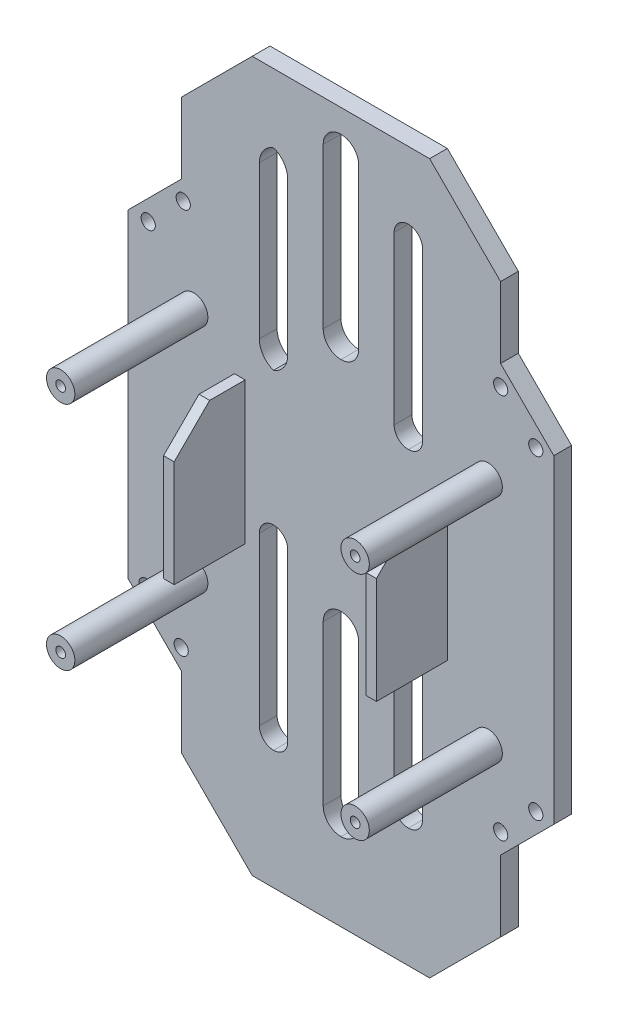
from build123d import *

# Parameters (mm, degrees)
ESQUISSE1_W             = 120
ESQUISSE1_H             = 120
BOSS_EXTRU_2_DEPTH      = 5
ESQUISSE9_R             = 4
BOSS_EXTRU_4_DEPTH      = 37.5
CHANFREIN5_SIZE         = 15
CHANFREIN6_SIZE         = 15
CHANFREIN7_SIZE         = 15
CHANFREIN8_SIZE         = 15
D_GAGEMENT_61_D         = 2.75
D_GAGEMENT_61_DEPTH     = 15
D_GAGEMENT_61_TIP       = 0.826183351
ESQUISSE21_W            = 90
ESQUISSE21_H            = 5
BOSS_EXTRU_7_DEPTH      = 40
ESQUISSE22_W            = 90
ESQUISSE22_H            = 5
BOSS_EXTRU_8_DEPTH      = 40
CHANFREIN23_SIZE        = 20
ESQUISSE23_R            = 2
ENL_V_MAT_EXTRU_1_DEPTH = 10
SKETCH1_W               = 10
SKETCH1_H               = 55
CUT_EXTRUDE2_DEPTH      = 5
FILLET2_R               = 5
FILLET3_R               = 5
SKETCH3_W               = 10
SKETCH3_H               = 55
CUT_EXTRUDE4_DEPTH      = 5
FILLET11_R              = 5
SKETCH2_W               = 8
SKETCH2_H               = 55
CUT_EXTRUDE5_DEPTH      = 8
SKETCH4_W               = 8
SKETCH4_H               = 55
CUT_EXTRUDE6_DEPTH      = 8
FILLET12_R              = 4
FILLET13_R              = 6
FILLET14_R              = 4
FILLET15_R              = 4
SKETCH5_W               = 3
SKETCH5_H               = 40
BOSS_EXTRUDE1_DEPTH     = 20
CHAMFER1_SIZE           = 10
CHAMFER2_SIZE           = 10


# Some blends are built 0.0001 mm under size
with BuildPart() as part:
    # Esquisse1 → Boss.-Extru.2 (new body)
    with BuildSketch(Plane.XY):
        with Locations((18.92806479, -29.794391972)):
            Rectangle(ESQUISSE1_W, ESQUISSE1_H)
    extrude(amount=BOSS_EXTRU_2_DEPTH)

    # Esquisse9 → Boss.-Extru.4 (add)
    with BuildSketch(Plane.XY.offset(5)):
        with Locations(Location((-22.57193521, -64.794391972, 0), (0, 0, 180))):
            Circle(ESQUISSE9_R)
        with Locations(Location((-22.57193521, 0.205608028, 0), (0, 0, 180))):
            Circle(ESQUISSE9_R)
        with Locations(Location((60.42806479, 0.205608028, 0), (0, 0, 180))):
            Circle(ESQUISSE9_R)
        with Locations(Location((60.42806479, -64.794391972, 0), (0, 0, 180))):
            Circle(ESQUISSE9_R)
    extrude(amount=BOSS_EXTRU_4_DEPTH)

    # Chanfrein5
    chanfrein5_edges = [part.edges().sort_by_distance(p)[0] for p in [
        (78.92806479, -89.794391972, 2.5),
    ]]
    chamfer(chanfrein5_edges, length=CHANFREIN5_SIZE)

    # Chanfrein6
    chanfrein6_edges = [part.edges().sort_by_distance(p)[0] for p in [
        (78.92806479, 30.205608028, 2.5),
    ]]
    chamfer(chanfrein6_edges, length=CHANFREIN6_SIZE)

    # Chanfrein7
    chanfrein7_edges = [part.edges().sort_by_distance(p)[0] for p in [
        (-41.07193521, 30.205608028, 2.5),
    ]]
    chamfer(chanfrein7_edges, length=CHANFREIN7_SIZE)

    # Chanfrein8
    chanfrein8_edges = [part.edges().sort_by_distance(p)[0] for p in [
        (-41.07193521, -89.794391972, 2.5),
    ]]
    chamfer(chanfrein8_edges, length=CHANFREIN8_SIZE)

    # Dégagement #61
    with Locations(Plane(origin=(-22.57193521, -64.794391972, 42.5), x_dir=(1, 0, 0), z_dir=(0, 0, 1))):
        with Locations((0, 0), (83, 0), (83, 65), (0, 65)):
            Hole(D_GAGEMENT_61_D / 2, depth=D_GAGEMENT_61_DEPTH)
            with Locations((0, 0, -(D_GAGEMENT_61_DEPTH + D_GAGEMENT_61_TIP / 2))):  # 118° drill point
                Cone(0, D_GAGEMENT_61_D / 2, D_GAGEMENT_61_TIP, mode=Mode.SUBTRACT)

    # Esquisse21 → Boss.-Extru.7 (add)
    with BuildSketch(Plane(origin=(0, -89.794391972, 0), x_dir=(-1, 0, 0), z_dir=(0, -1, 0))):
        with Locations((-18.92806479, -2.5)):
            Rectangle(ESQUISSE21_W, ESQUISSE21_H)
    extrude(amount=BOSS_EXTRU_7_DEPTH)

    # Esquisse22 → Boss.-Extru.8 (add)
    with BuildSketch(Plane(origin=(0, 30.205608028, 0), x_dir=(1, 0, 0), z_dir=(0, 1, 0))):
        with Locations((18.92806479, -2.5)):
            Rectangle(ESQUISSE22_W, ESQUISSE22_H)
    extrude(amount=BOSS_EXTRU_8_DEPTH)

    # Chanfrein23
    chanfrein23_edges = [part.edges().sort_by_distance(p)[0] for p in [
        (-26.07193521, -129.794391972, 2.5),
        (63.92806479, -129.794391972, 2.5),
        (63.92806479, 70.205608028, 2.5),
        (-26.07193521, 70.205608028, 2.5),
    ]]
    chamfer(chanfrein23_edges, length=CHANFREIN23_SIZE)

    # Esquisse23 → Enlèv. mat.-Extru.1 (cut)
    with BuildSketch(Plane.XY.offset(5)):
        with Locations((-35.996277988, -74.213194945)):
            Circle(ESQUISSE23_R)
        with Locations((-26.096783051, -84.112689881)):
            Circle(ESQUISSE23_R)
        with Locations((-25.52408096, 25.096608028)):
            Circle(ESQUISSE23_R)
        with Locations((-35.390089468, 15.163739554)):
            Circle(ESQUISSE23_R)
        with Locations((63.953155144, 24.523663425)):
            Circle(ESQUISSE23_R)
        with Locations((73.85265008, 14.624168488)):
            Circle(ESQUISSE23_R)
        with Locations((63.953210541, -84.112391972)):
            Circle(ESQUISSE23_R)
        with Locations((73.852705477, -74.212897035)):
            Circle(ESQUISSE23_R)
    extrude(amount=-ENL_V_MAT_EXTRU_1_DEPTH, mode=Mode.SUBTRACT)

    # Sketch1 → Cut-Extrude2 (cut)
    with BuildSketch(Plane.XY.offset(5)):
        with Locations((18.92806479, -80.294391972)):
            Rectangle(SKETCH1_W, SKETCH1_H)
    extrude(amount=-CUT_EXTRUDE2_DEPTH, mode=Mode.SUBTRACT)

    # Fillet2
    fillet2_edges = [part.edges().sort_by_distance(p)[0] for p in [
        (13.92806479, -107.794391972, 2.5),
    ]]
    fillet(fillet2_edges, radius=FILLET2_R)

    # Fillet3
    fillet3_edges = [part.edges().sort_by_distance(p)[0] for p in [
        (13.92806479, -52.794391972, 2.5),
        (23.92806479, -52.794391972, 2.5),
        (23.92806479, -107.794391972, 2.5),
    ]]
    fillet(fillet3_edges, radius=FILLET3_R - 0.0001)  # a hair under: the kernel refuses the full size

    # Sketch3 → Cut-Extrude4 (cut)
    with BuildSketch(Plane.XY.offset(5)):
        with Locations((18.92806479, 36.166130895)):
            Rectangle(SKETCH3_W, SKETCH3_H)
    extrude(amount=-CUT_EXTRUDE4_DEPTH, mode=Mode.SUBTRACT)

    # Fillet11
    fillet11_edges = [part.edges().sort_by_distance(p)[0] for p in [
        (13.92806479, 63.666130895, 2.5),
        (23.92806479, 63.666130895, 2.5),
        (23.92806479, 8.666130895, 2.5),
        (13.92806479, 8.666130895, 2.5),
    ]]
    fillet(fillet11_edges, radius=FILLET11_R - 0.0001)  # a hair under: the kernel refuses the full size

    # Sketch2 → Cut-Extrude5 (cut)
    with BuildSketch(Plane.XY.offset(5)):
        with Locations((37.92806479, -68.710279878)):
            Rectangle(SKETCH2_W, SKETCH2_H)
        with Locations((-0.07193521, -68.710279878)):
            Rectangle(SKETCH2_W, SKETCH2_H)
    extrude(amount=-CUT_EXTRUDE5_DEPTH, mode=Mode.SUBTRACT)

    # Sketch4 → Cut-Extrude6 (cut)
    with BuildSketch(Plane.XY.offset(5)):
        with Locations((-0.07193521, 23.705608028)):
            Rectangle(SKETCH4_W, SKETCH4_H)
        with Locations((37.92806479, 23.705608028)):
            Rectangle(SKETCH4_W, SKETCH4_H)
    extrude(amount=-CUT_EXTRUDE6_DEPTH, mode=Mode.SUBTRACT)

    # Fillet12
    fillet12_edges = [part.edges().sort_by_distance(p)[0] for p in [
        (33.92806479, 51.205608028, 2.5),
        (41.92806479, 51.205608028, 2.5),
        (41.92806479, -3.794391972, 2.5),
        (33.92806479, -3.794391972, 2.5),
    ]]
    fillet(fillet12_edges, radius=FILLET12_R - 0.0001)  # a hair under: the kernel refuses the full size

    # Fillet13
    # the kernel refuses this fillet: 6 mm, written as the material it adds along each edge
    with BuildSketch(Plane(origin=(-4.07193521, -3.794391972, 5), x_dir=(1, 0, 0), z_dir=(0, 0, -1)), Plane(origin=(3.92806479, -3.794391972, 5), x_dir=(0, 1, 0), z_dir=(0, 0, -1)), Plane(origin=(-4.07193521, 51.205608028, 5), x_dir=(0, -1, 0), z_dir=(0, 0, -1))) as fillet13_piece_1:
        with BuildLine():
            CenterArc((FILLET13_R, -FILLET13_R), FILLET13_R, 90, 90)
            Line((0, -FILLET13_R), (0, 0))
            Line((0, 0), (FILLET13_R, 0))
        make_face()
    extrude(amount=5)
    with BuildSketch(Plane(origin=(3.92806479, 51.205608028, 5), x_dir=(0, -1, 0), z_dir=(0, 0, -1))) as fillet13_piece_2:
        with BuildLine():
            CenterArc((FILLET13_R, FILLET13_R), FILLET13_R, 180, 90)
            Line((0, FILLET13_R), (0, 0))
            Line((0, 0), (FILLET13_R, 0))
        make_face()
    extrude(amount=5)

    # Fillet14
    fillet14_edges = [part.edges().sort_by_distance(p)[0] for p in [
        (3.92806479, -41.210279878, 2.5),
        (-4.07193521, -41.210279878, 2.5),
        (-4.07193521, -96.210279878, 2.5),
        (3.92806479, -96.210279878, 2.5),
    ]]
    fillet(fillet14_edges, radius=FILLET14_R - 0.0001)  # a hair under: the kernel refuses the full size

    # Fillet15
    fillet15_edges = [part.edges().sort_by_distance(p)[0] for p in [
        (41.92806479, -96.210279878, 2.5),
        (33.92806479, -96.210279878, 2.5),
        (33.92806479, -41.210279878, 2.5),
        (41.92806479, -41.210279878, 2.5),
    ]]
    fillet(fillet15_edges, radius=FILLET15_R - 0.0001)  # a hair under: the kernel refuses the full size

    # Sketch5 → Boss-Extrude1 (add)
    with BuildSketch(Plane.XY.offset(5)):
        with Locations((-9.57193521, -29.794391972)):
            Rectangle(SKETCH5_W, SKETCH5_H)
        with Locations((47.42806479, -29.794391972)):
            Rectangle(SKETCH5_W, SKETCH5_H)
    extrude(amount=BOSS_EXTRUDE1_DEPTH)

    # Chamfer1
    chamfer1_edges = [part.edges().sort_by_distance(p)[0] for p in [
        (47.42806479, -9.794391972, 25),
    ]]
    chamfer(chamfer1_edges, length=CHAMFER1_SIZE)

    # Chamfer2
    chamfer2_edges = [part.edges().sort_by_distance(p)[0] for p in [
        (-9.57193521, -9.794391972, 25),
    ]]
    chamfer(chamfer2_edges, length=CHAMFER2_SIZE)


solid = part.part
